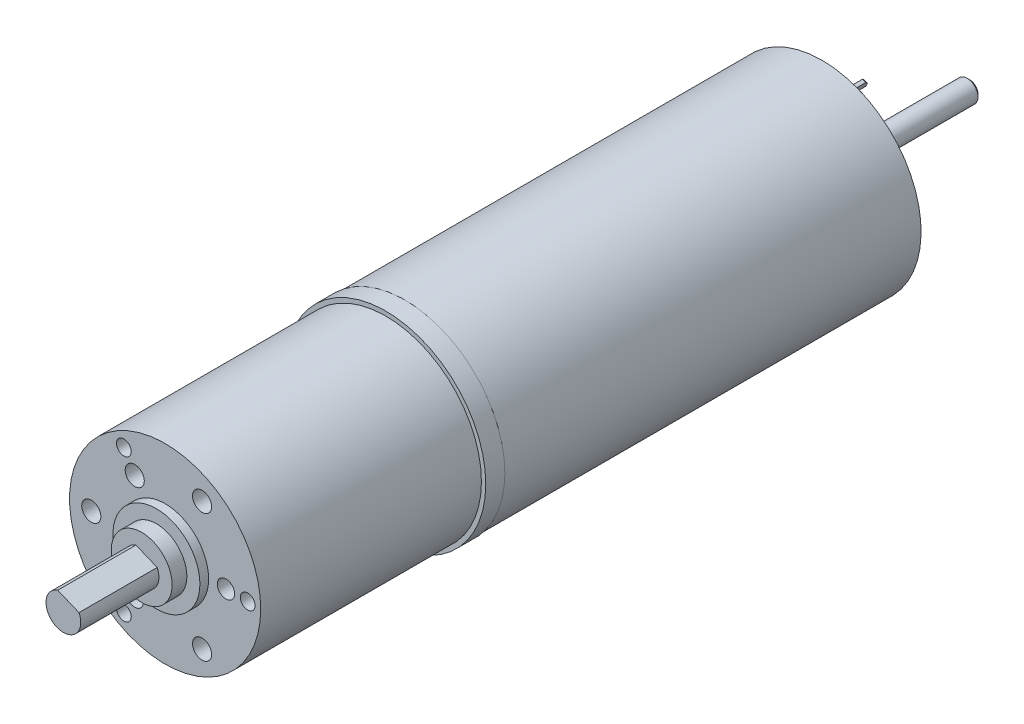
from build123d import *

# Parameters (mm, degrees)
CROQUIS1_W                          = 11.5
CROQUIS1_H                          = 2.2
CROQUIS2_R                          = 11.4
SALIENTE_EXTRUIR1_DEPTH             = 48
SALIENTE_EXTRUIR2_DEPTH             = 0.4
CORTAR_EXTRUIR1_DEPTH               = 55.027539947
SALIENTE_EXTRUIR3_DEPTH             = 0.4
CORTAR_EXTRUIR2_DEPTH               = 55.027539947
SALIENTE_EXTRUIR4_DEPTH             = 3
CROQUIS8_R                          = 11
SALIENTE_EXTRUIR5_DEPTH             = 25.4
CROQUIS9_R                          = 5
SALIENTE_EXTRUIR6_DEPTH             = 1
CROQUIS10_R                         = 3.5
SALIENTE_EXTRUIR7_DEPTH             = 1.7
SALIENTE_EXTRUIR8_DEPTH             = 9
CROQUIS12_W                         = 1.25
CROQUIS12_H                         = 14
CROQUIS13_W                         = 0.9
CROQUIS13_H                         = 4.4
CROQUIS14_W                         = 0.9
CROQUIS14_H                         = 4.4
CROQUIS15_W                         = 0.9
CROQUIS15_H                         = 4.4
CROQUIS16_W                         = 0.9
CROQUIS16_H                         = 4.4
CROQUIS17_W                         = 0.9
CROQUIS17_H                         = 4.4
CROQUIS18_W                         = 0.9
CROQUIS18_H                         = 4.4
DI_METRO_DE_TALADRO_2_0_2_1_D       = 2
DI_METRO_DE_TALADRO_2_0_2_1_DEPTH   = 7.3
DI_METRO_DE_TALADRO_1_7_1_7_1_D     = 1.7
DI_METRO_DE_TALADRO_1_7_1_7_1_DEPTH = 7.3
DI_METRO_DE_TALADRO_2_2_2_2_1_D     = 2.2
DI_METRO_DE_TALADRO_2_2_2_2_1_DEPTH = 7.3
NERVIO1_START                       = -0.75
NERVIO1_OUTLINE_W                   = 3
NERVIO1_OUTLINE_H                   = 3.2
NERVIO1_DEPTH                       = 1.5
CHAFL_N1_SIZE                       = 0.3


# Read off the part's stored shape, not the designer's step: Nervio1
with BuildPart() as part:
    # Croquis1 → Revolución1 (revolve)
    with BuildSketch(Plane(origin=(0, 0, 0), x_dir=(1, 0, 0), z_dir=(0, 1, 0))):
        with Locations((5.75, -1.1)):
            Rectangle(CROQUIS1_W, CROQUIS1_H)
    revolve(axis=Axis((0, 0, 0), (0, 0, 1)))

    # Croquis2 → Saliente-Extruir1 (add)
    with BuildSketch(Plane(origin=(0, 0, 0), x_dir=(-1, 0, 0), z_dir=(0, 0, -1))):
        with Locations(Location((0, 0, 0), (0, 0, 90))):
            Circle(CROQUIS2_R)
    extrude(amount=SALIENTE_EXTRUIR1_DEPTH)

    # Croquis3 → Saliente-Extruir2 (add)
    with BuildSketch(Plane(origin=(-1.187185199, 0.491748211, 0), x_dir=(0.38268343236508984, 0.9238795325112867, 0), z_dir=(0.9238795325112867, -0.38268343236508984, 0))):
        Polygon((7.1, -51), (8.9, -51), (9.2, -50.7), (9.2, -48), (6.8, -48), (6.8, -50.7), align=None)
    extrude(amount=-SALIENTE_EXTRUIR2_DEPTH)

    # Croquis4 → Cortar-Extruir1 (cut, through all)
    with BuildSketch(Plane(origin=(-1.556737012, 0.644821584, 0), x_dir=(0, 0, 1), z_dir=(-0.9238795325112865, 0.3826834323650905, 0))):
        with BuildLine():
            Line((-51, 8.5), (-51, 7.5))
            Line((-51, 7.5), (-49.8, 7.5))
            ThreePointArc((-49.8, 7.5), (-49.3, 8), (-49.8, 8.5))
            Line((-49.8, 8.5), (-51, 8.5))
        make_face()
    extrude(amount=-CORTAR_EXTRUIR1_DEPTH, mode=Mode.SUBTRACT)

    # Croquis5 → Saliente-Extruir3 (add)
    with BuildSketch(Plane(origin=(1.187185199, -0.491748211, 0), x_dir=(-0.3826834323650898, -0.9238795325112867, 0), z_dir=(-0.9238795325112867, 0.3826834323650898, 0))):
        Polygon((7.1, -51), (8.9, -51), (9.2, -50.7), (9.2, -48), (6.8, -48), (6.8, -50.7), align=None)
    extrude(amount=-SALIENTE_EXTRUIR3_DEPTH)

    # Croquis6 → Cortar-Extruir2 (cut, through all)
    with BuildSketch(Plane(origin=(1.556737012, -0.644821584, 0), x_dir=(0, 0, -1), z_dir=(0.9238795325112837, -0.38268343236509744, -9.353628982466952e-15))):
        with BuildLine():
            Line((51, -7.5), (49.8, -7.5))
            ThreePointArc((49.8, -7.5), (49.3, -8), (49.8, -8.5))
            Line((49.8, -8.5), (51, -8.5))
            Line((51, -8.5), (51, -7.5))
        make_face()
    extrude(amount=-CORTAR_EXTRUIR2_DEPTH, mode=Mode.SUBTRACT)

    # Croquis7 → Saliente-Extruir4 (add)
    with BuildSketch(Plane(origin=(0, 0, -48), x_dir=(-1, 0, 0), z_dir=(0, 0, -1))):
        with BuildLine():
            Line((-4.326858651, 2.699684096), (1.150586162, 4.968516024))
            ThreePointArc((1.150586162, 4.968516024), (4.711785616, 1.951685505), (4.326858651, -2.699684096))
            Line((4.326858651, -2.699684096), (-1.150586162, -4.968516024))
            ThreePointArc((-1.150586162, -4.968516024), (-4.711785616, -1.951685505), (-4.326858651, 2.699684096))
        make_face()
    extrude(amount=SALIENTE_EXTRUIR4_DEPTH)

    # Croquis8 → Saliente-Extruir5 (add)
    with BuildSketch(Plane.XY.offset(2.2)):
        Circle(CROQUIS8_R)
    extrude(amount=SALIENTE_EXTRUIR5_DEPTH)

    # Croquis9 → Saliente-Extruir6 (add)
    with BuildSketch(Plane.XY.offset(27.6)):
        Circle(CROQUIS9_R)
    extrude(amount=SALIENTE_EXTRUIR6_DEPTH)

    # Croquis10 → Saliente-Extruir7 (add)
    with BuildSketch(Plane.XY.offset(28.6)):
        Circle(CROQUIS10_R)
    extrude(amount=SALIENTE_EXTRUIR7_DEPTH)

    # Croquis11 → Saliente-Extruir8 (add)
    with BuildSketch(Plane.XY.offset(30.3)):
        with BuildLine():
            Line((-0.660243548, 1.897070133), (1.784111936, 0.88458494))
            ThreePointArc((1.784111936, 0.88458494), (-0.777457819, -1.842750828), (-0.660243548, 1.897070133))
        make_face()
    extrude(amount=SALIENTE_EXTRUIR8_DEPTH)

    # Croquis12 → Revolución2 (revolve)
    with BuildSketch(Plane(origin=(0, 0, 0), x_dir=(1, 0, 0), z_dir=(0, 1, 0))):
        with Locations((0.625, 58)):
            Rectangle(CROQUIS12_W, CROQUIS12_H)
    revolve(axis=Axis((0, 0, -65), (0, 0, 1)))

    # Croquis13 → Cortar-Revolución1 (revolve, cut)
    with BuildSketch(Plane(origin=(0, -7.852976026, 0), x_dir=(1, 0, 0), z_dir=(0, 1, 0))):
        with Locations((3.702809175, 2.2)):
            Rectangle(CROQUIS13_W, CROQUIS13_H)
    revolve(axis=Axis((3.252809175, -7.852976026, -4.4), (0, 0, 1)), mode=Mode.SUBTRACT)

    # Croquis14 → Cortar-Revolución2 (revolve, cut)
    with BuildSketch(Plane(origin=(0, 2.678784027, 0), x_dir=(1, 0, 0), z_dir=(0, 1, 0))):
        with Locations((6.917156728, 2.2)):
            Rectangle(CROQUIS14_W, CROQUIS14_H)
    revolve(axis=Axis((6.467156728, 2.678784027, -4.4), (0, 0, 1)), mode=Mode.SUBTRACT)

    # Croquis15 → Cortar-Revolución3 (revolve, cut)
    with BuildSketch(Plane(origin=(0, -2.678784027, 0), x_dir=(1, 0, 0), z_dir=(0, 1, 0))):
        with Locations((-6.017156728, 2.2)):
            Rectangle(CROQUIS15_W, CROQUIS15_H)
    revolve(axis=Axis((-6.467156728, -2.678784027, -4.4), (0, 0, 1)), mode=Mode.SUBTRACT)

    # Croquis16 → Cortar-Revolución4 (revolve, cut)
    with BuildSketch(Plane(origin=(0, 6.743503392, 0), x_dir=(1, 0, 0), z_dir=(0, 1, 0))):
        with Locations((5.624472147, 2.2)):
            Rectangle(CROQUIS16_W, CROQUIS16_H)
    revolve(axis=Axis((5.174472147, 6.743503392, -4.4), (0, 0, 1)), mode=Mode.SUBTRACT)

    # Croquis17 → Cortar-Revolución5 (revolve, cut)
    with BuildSketch(Plane(origin=(0, 1.109472634, 0), x_dir=(1, 0, 0), z_dir=(0, 1, 0))):
        with Locations((-7.977281322, 2.2)):
            Rectangle(CROQUIS17_W, CROQUIS17_H)
    revolve(axis=Axis((-8.427281322, 1.109472634, -4.4), (0, 0, 1)), mode=Mode.SUBTRACT)

    # Croquis18 → Cortar-Revolución6 (revolve, cut)
    with BuildSketch(Plane(origin=(0, 7.852976026, 0), x_dir=(1, 0, 0), z_dir=(0, 1, 0))):
        with Locations((-2.802809175, 2.2)):
            Rectangle(CROQUIS18_W, CROQUIS18_H)
    revolve(axis=Axis((-3.252809175, 7.852976026, -4.4), (0, 0, 1)), mode=Mode.SUBTRACT)

    # Diámetro de taladro Ø2.0 (2)1
    with Locations(Plane.XY.offset(27.6)):
        with Locations((-3.5, -6.062177826), (7, 0)):
            Hole(DI_METRO_DE_TALADRO_2_0_2_1_D / 2, depth=DI_METRO_DE_TALADRO_2_0_2_1_DEPTH)

    # Diámetro de taladro Ø1.7 (1.7)1
    with Locations(Plane.XY.offset(27.6)):
        with Locations((9.5, 0), (-4.75, 8.227241336), (-4.75, -8.227241336)):
            Hole(DI_METRO_DE_TALADRO_1_7_1_7_1_D / 2, depth=DI_METRO_DE_TALADRO_1_7_1_7_1_DEPTH)

    # Diámetro de taladro Ø2.2 (2.2)1
    with Locations(Plane.XY.offset(27.6)):
        with Locations((4.25, 7.361215932), (-8.5, 0), (-3.5, 6.062177826), (4.25, -7.361215932)):
            Hole(DI_METRO_DE_TALADRO_2_2_2_2_1_D / 2, depth=DI_METRO_DE_TALADRO_2_2_2_2_1_DEPTH)

    # Nervio1 outline → Nervio1 (add)
    with BuildSketch(Plane(origin=(0, 0, 0), x_dir=(0.38268343236508995, -0.9238795325112867, 0), z_dir=(-0.9238795325112867, -0.38268343236508995, 0)).offset(NERVIO1_START)):
        with Locations((-5.5, -48.6)):
            Rectangle(NERVIO1_OUTLINE_W, NERVIO1_OUTLINE_H)
    extrude(amount=NERVIO1_DEPTH)

    # Chaflán1
    chafl_n1_edges = [part.edges().sort_by_distance(p)[0] for p in [
        (-1.25, 0, -65),
    ]]
    chamfer(chafl_n1_edges, length=CHAFL_N1_SIZE)


solid = part.part
